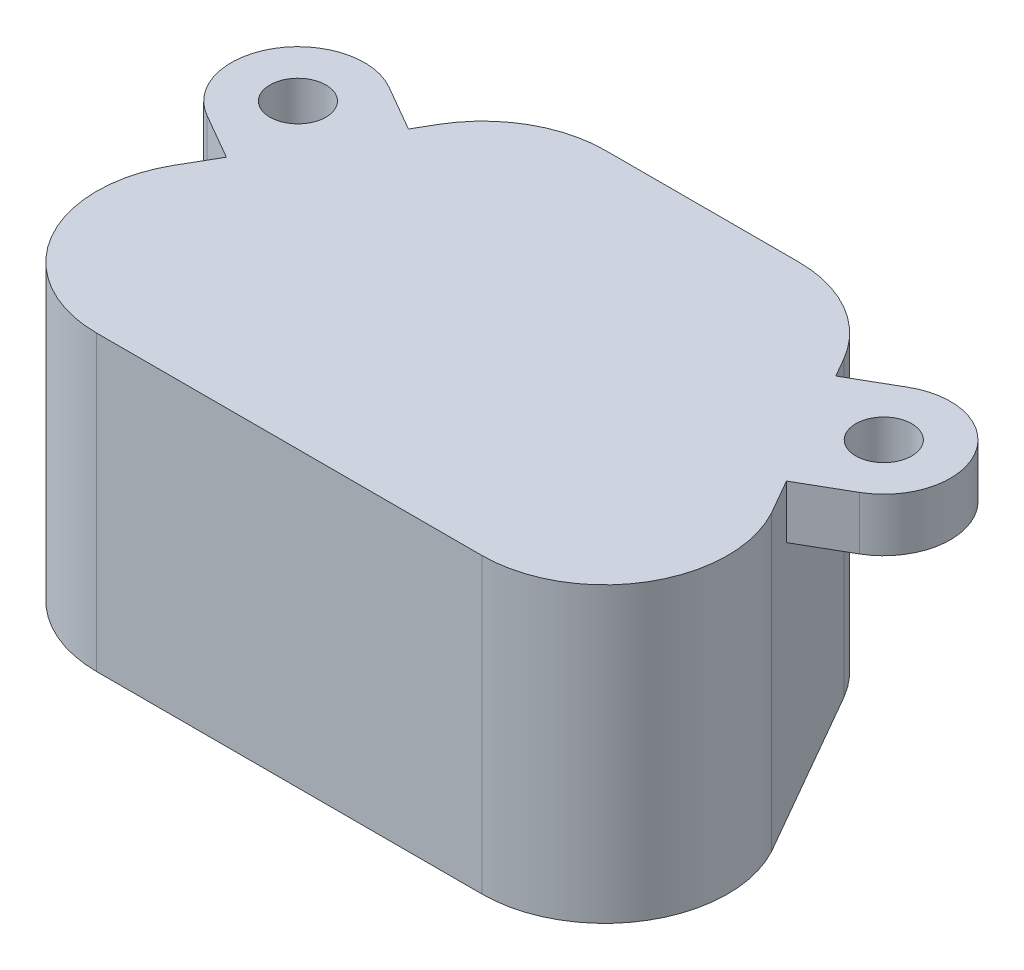
from build123d import *

# Parameters (mm, degrees)
BOSS_EXTRUDE1_DEPTH = 20
BOSS_EXTRUDE4_DEPTH = 2
SKETCH9_R           = 2.1
BOSS_EXTRUDE5_DEPTH = 4


with BuildPart() as part:
    # Sketch1 → Boss-Extrude1 (new body)
    with BuildSketch(Plane(origin=(0, 0, 0), x_dir=(1, 0, 0), z_dir=(0, 1, 0))):
        with BuildLine():
            Line((-47.421696664, 8.493167766), (-32.921696664, 8.493167766))
            ThreePointArc((-32.921696664, 8.493167766), (-28.309146849, 7.256965456), (-24.933036081, 3.879734634))
            Line((-24.933036081, 3.879734634), (-17.636401145, -8.844865692))
            ThreePointArc((-17.636401145, -8.844865692), (-17.820612025, -17.958509448), (-25.745395692, -22.46297834))
            Line((-25.745395692, -22.46297834), (-54.645395692, -22.46297834))
            ThreePointArc((-54.645395692, -22.46297834), (-62.607823184, -17.894709582), (-62.682753297, -8.715182552))
            Line((-62.682753297, -8.715182552), (-55.348980831, 3.984497041))
            ThreePointArc((-55.348980831, 3.984497041), (-51.981574567, 7.287152643), (-47.421696664, 8.493167766))
        make_face()
        with BuildLine():
            Line((-47.421696664, 6.493167766), (-32.921696664, 6.493167766))
            ThreePointArc((-32.921696664, 6.493167766), (-29.310446688, 5.525665157), (-26.666587696, 2.882334433))
            Line((-26.666587696, 2.882334433), (-19.384059263, -9.817665567))
            ThreePointArc((-19.384059263, -9.817665567), (-19.544805292, -16.944941641), (-25.745395692, -20.46297834))
            Line((-25.745395692, -20.46297834), (-54.645395692, -20.46297834))
            ThreePointArc((-54.645395692, -20.46297834), (-60.878636724, -16.889747838), (-60.944972269, -9.705259715))
            Line((-60.944972269, -9.705259715), (-53.623842396, 2.97252707))
            ThreePointArc((-53.623842396, 2.97252707), (-50.987559904, 5.551646576), (-47.421696664, 6.493167766))
        make_face(mode=Mode.SUBTRACT)
    extrude(amount=BOSS_EXTRUDE1_DEPTH)

    # Sketch8 → Boss-Extrude4 (add)
    with BuildSketch(Plane(origin=(0, 20, 0), x_dir=(1, 0, 0), z_dir=(0, 1, 0))):
        with BuildLine():
            Line((-55.348980831, 3.984497041), (-62.682753297, -8.715182552))
            ThreePointArc((-62.682753297, -8.715182552), (-62.607823184, -17.894709582), (-54.645395692, -22.462978339))
            Line((-54.645395692, -22.462978339), (-25.745395692, -22.46297834))
            ThreePointArc((-25.745395692, -22.46297834), (-17.820612025, -17.958509448), (-17.636401145, -8.844865692))
            Line((-17.636401145, -8.844865692), (-24.933036081, 3.879734634))
            ThreePointArc((-24.933036081, 3.879734634), (-28.309146849, 7.256965456), (-32.921696664, 8.493167766))
            Line((-32.921696664, 8.493167766), (-47.421696664, 8.493167766))
            ThreePointArc((-47.421696664, 8.493167766), (-51.981574567, 7.287152643), (-55.348980831, 3.984497041))
        make_face()
    extrude(amount=BOSS_EXTRUDE4_DEPTH)

    # Sketch9 → Boss-Extrude5 (add)
    # profile 1 of 2: a face of its own
    with BuildSketch(Plane(origin=(0, 22, 0), x_dir=(1, 0, 0), z_dir=(0, 1, 0))):
        with BuildLine():
            Line((-59.674100701, 4.493496912), (-56.210189139, 2.493167766))
            Line((-56.210189139, 2.493167766), (-61.211012004, -6.166611138))
            Line((-61.211012004, -6.166611138), (-64.674923565, -4.166281993))
            ThreePointArc((-64.674923565, -4.166281993), (-66.504401585, 2.664018892), (-59.674100701, 4.493496912))
        make_face()
        with Locations((-62.174512133, 0.16360746)):
            Circle(SKETCH9_R, mode=Mode.SUBTRACT)
    # profile 2 of 2: a face of its own
    with BuildSketch(Plane(origin=(0, 22, 0), x_dir=(1, 0, 0), z_dir=(0, 1, 0))):
        with BuildLine():
            Line((-19.154852081, -6.198807979), (-24.142409797, 2.468617708))
            Line((-24.142409797, 2.468617708), (-20.675439522, 4.463640794))
            ThreePointArc((-20.675439522, 4.463640794), (-13.847947821, 2.623706808), (-15.687881807, -4.203784893))
            Line((-15.687881807, -4.203784893), (-19.154852081, -6.198807979))
        make_face()
        with Locations((-18.181660664, 0.12992795)):
            Circle(SKETCH9_R, mode=Mode.SUBTRACT)
    extrude(amount=-BOSS_EXTRUDE5_DEPTH)


solid = part.part
